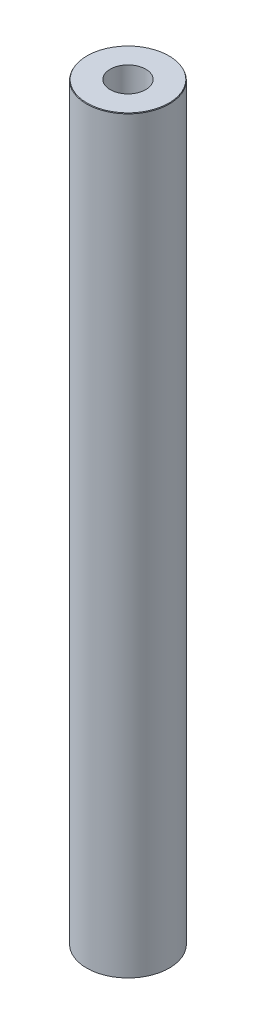
from build123d import *
from OCP.BRepFilletAPI import BRepFilletAPI_MakeChamfer

# Parameters (mm, degrees)
SKETCH1_R           = 25
BOSS_EXTRUDE1_DEPTH = 453.369519557
SKETCH2_R           = 10.761992849
CUT_EXTRUDE1_DEPTH  = 455.745996424
CHAMFER1_SIZE       = 0.400966774
CHAMFER1_SIZE2      = 0.231498275


with BuildPart() as part:
    # Sketch1 → Boss-Extrude1 (new body)
    with BuildSketch(Plane(origin=(0, 0, 0), x_dir=(1, 0, 0), z_dir=(0, 1, 0))):
        Circle(SKETCH1_R)
    extrude(amount=BOSS_EXTRUDE1_DEPTH)

    # Sketch2 → Cut-Extrude1 (cut, through all)
    with BuildSketch(Plane(origin=(0, 0, 0), x_dir=(1, 0, 0), z_dir=(0, 1, 0))):
        Circle(SKETCH2_R)
    extrude(amount=CUT_EXTRUDE1_DEPTH, mode=Mode.SUBTRACT)

    # Chamfer1: one chamfer whose edges measure the first distance from different faces: ONE call of the kernel's chamfer builder (chamfer() names one face for all edges)
    chamfer1_edges_1 = [part.edges().sort_by_distance(p)[0] for p in [
        (-25, 453.369519557, 0),
    ]]
    chamfer1_side_1 = [part.faces().sort_by_distance(p)[0] for p in [
        (-25, 226.684759779, 0),
    ]]
    chamfer1_edges_2 = [part.edges().sort_by_distance(p)[0] for p in [
        (-25, 0, 0),
    ]]
    chamfer1_side_2 = [part.faces().sort_by_distance(p)[0] for p in [
        (-24.292893219, 0, 0),
    ]]
    chamfer1 = BRepFilletAPI_MakeChamfer(part.part.solid().wrapped)
    for e in chamfer1_edges_1:
        chamfer1.Add(CHAMFER1_SIZE, CHAMFER1_SIZE2, e.wrapped, chamfer1_side_1[0].wrapped)  # the first distance lies on this face
    for e in chamfer1_edges_2:
        chamfer1.Add(CHAMFER1_SIZE, CHAMFER1_SIZE2, e.wrapped, chamfer1_side_2[0].wrapped)  # the first distance lies on this face
    add(Compound.cast(chamfer1.Shape()), mode=Mode.REPLACE)


solid = part.part
